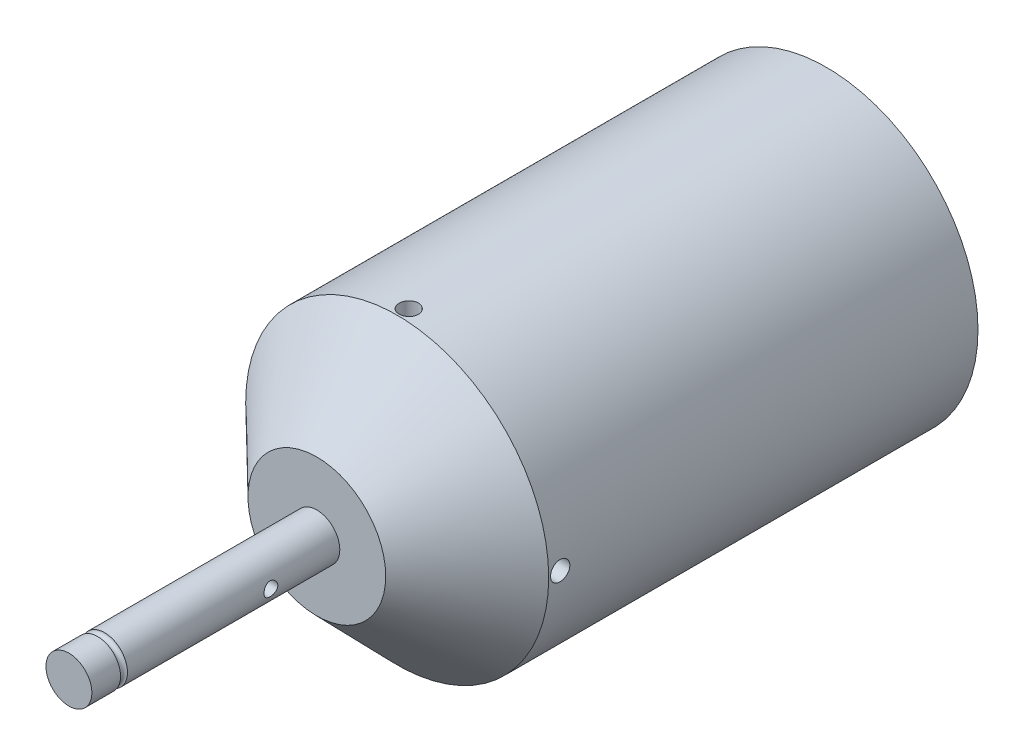
from build123d import *

# Parameters (mm, degrees)
SKETCH1_R               = 33
BOSS_EXTRUDE1_DEPTH     = 46.75
CUT_EXTRUDE1_START      = -114.313999576
SKETCH11_R              = 2.1
CUT_EXTRUDE1_DEPTH      = 124.313999576
CIRPATTERN1_COUNT       = 4
SKETCH12_R              = 5
BOSS_EXTRUDE5_DEPTH     = 54
CUT_EXTRUDE2_DEPTH      = 128.126167698
CUT_EXTRUDE2_DEPTH_BACK = 128.126167698
SKETCH13_R              = 1.5
SKETCH14_R              = 0.75


with BuildPart() as part:
    # Sketch1 → Boss-Extrude1 (new, symmetric)
    with BuildSketch(Plane.XY):
        Circle(SKETCH1_R)
    extrude(amount=BOSS_EXTRUDE1_DEPTH, both=True)

    # Sketch10 → Revolve1 (revolve)
    with BuildSketch(Plane(origin=(0, 0, 0), x_dir=(0, 0, -1), z_dir=(1, 0, 0))):
        Polygon((-64.25, 0), (-64.25, 15), (-46.75, 33), (-46.75, 0), align=None)
    revolve(axis=Axis((0, 0, 1000), (0, 0, -1)))

    # Sketch11 → Cut-Extrude1 (cut)
    with BuildSketch(Plane(origin=(-33, 33, 0), x_dir=(0, 0, -1), z_dir=(0, -1, 0)).offset(CUT_EXTRUDE1_START)):
        with Locations((-44.25, 33)):
            Circle(SKETCH11_R)
    cut_extrude1 = extrude(amount=CUT_EXTRUDE1_DEPTH, mode=Mode.SUBTRACT)

    # CirPattern1: Cut-Extrude1 ×4 about axis
    cirpattern1_axis = Axis((0, 0, 46.75), (0, 0, 1))
    for i in range(1, CIRPATTERN1_COUNT):
        add(cut_extrude1.rotate(cirpattern1_axis, i * 360 / CIRPATTERN1_COUNT), mode=Mode.SUBTRACT)

    # Sketch12 → Boss-Extrude5 (add)
    with BuildSketch(Plane.XY.offset(64.25)):
        Circle(SKETCH12_R)
    extrude(amount=BOSS_EXTRUDE5_DEPTH)

    # Sketch13 → Cut-Extrude2 (cut, two sides: drawn at the far end of the back side and taken through both)
    with BuildSketch(Plane(origin=(0, 0, 0), x_dir=(0, 0, -1), z_dir=(1, 0, 0)).offset(-CUT_EXTRUDE2_DEPTH_BACK)):
        with Locations((-79.25, 0)):
            Circle(SKETCH13_R)
    extrude(amount=CUT_EXTRUDE2_DEPTH + CUT_EXTRUDE2_DEPTH_BACK, mode=Mode.SUBTRACT)

    # Sketch14 → Cut-Revolve1 (revolve, cut)
    with BuildSketch(Plane(origin=(0, 0, 0), x_dir=(0, 0, -1), z_dir=(1, 0, 0))):
        with Locations((-111.25, 5)):
            Circle(SKETCH14_R)
    revolve(axis=Axis((0, 0, 118.25), (0, 0, -1)), mode=Mode.SUBTRACT)


solid = part.part
